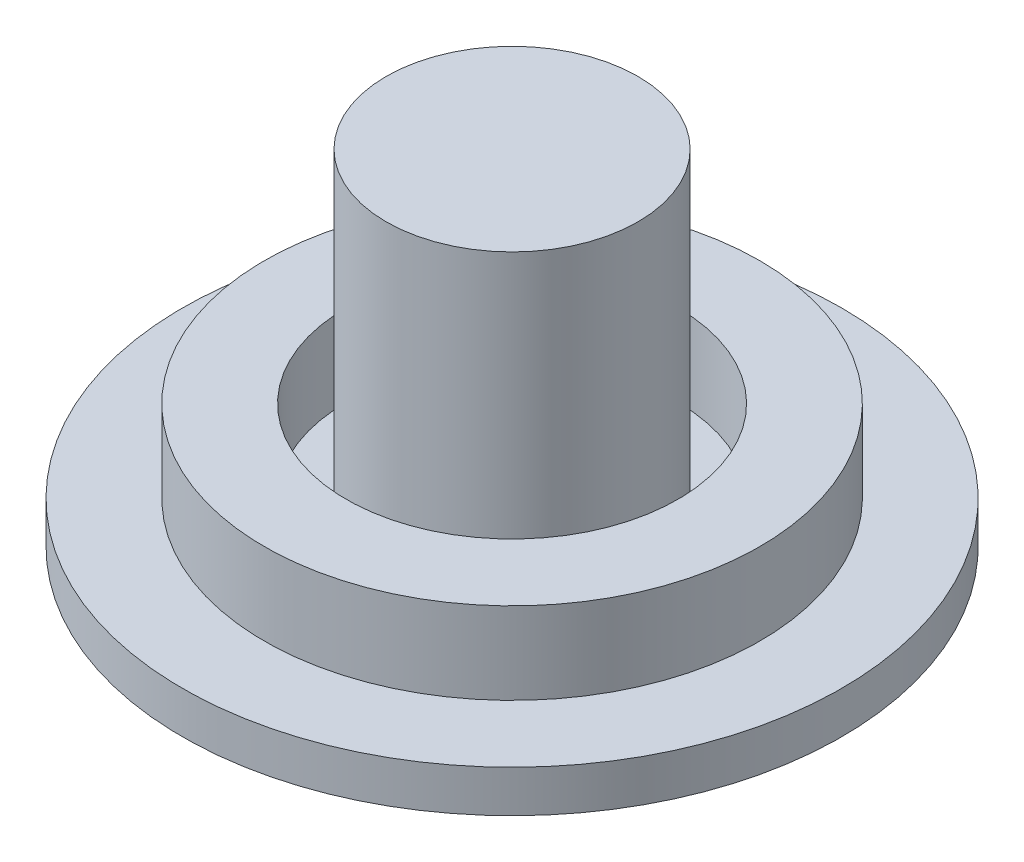
from build123d import *


with BuildPart() as part:
    # Sketch2 → Revolve1 (revolve)
    with BuildSketch(Plane(origin=(0, 0, 0), x_dir=(0, 0, -1), z_dir=(1, 0, 0))):
        Polygon((0, 8.2), (3, 8.2), (3, 1), (3.95, 1), (3.95, 2.95), (5.9, 2.95), (5.9, 1), (7.85, 1), (7.85, 0), (0, 0), align=None)
    revolve(axis=Axis((0, 0, 0), (0, 1, 0)))


solid = part.part
